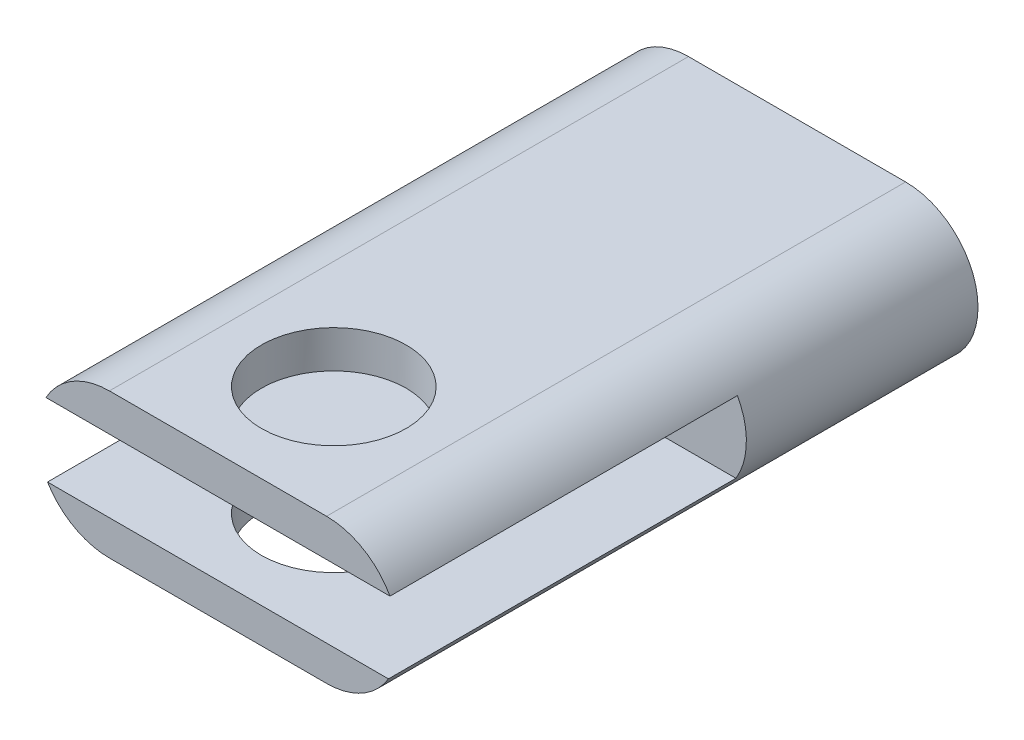
from build123d import *

# Parameters (mm, degrees)
BOSS_EXTRUDE1_DEPTH = 2000
SKETCH2_W           = 1250
SKETCH2_H           = 250
CUT_EXTRUDE1_DEPTH  = 1200
SKETCH3_R           = 250
CUT_EXTRUDE2_DEPTH  = 2155.210992452


with BuildPart() as part:
    # Sketch1 → Boss-Extrude1 (new body)
    with BuildSketch(Plane.XY):
        with BuildLine():
            Line((-375, 250), (375, 250))
            ThreePointArc((375, 250), (625, 0), (375, -250))
            Line((375, -250), (-375, -250))
            ThreePointArc((-375, -250), (-625, 0), (-375, 250))
        make_face()
    extrude(amount=BOSS_EXTRUDE1_DEPTH)

    # Sketch2 → Cut-Extrude1 (cut)
    with BuildSketch(Plane.XY.offset(2000)):
        with Locations((0, -4.467277721)):
            Rectangle(SKETCH2_W, SKETCH2_H)
    extrude(amount=-CUT_EXTRUDE1_DEPTH, mode=Mode.SUBTRACT)

    # Sketch3 → Cut-Extrude2 (cut, through all)
    with BuildSketch(Plane(origin=(0, 250, 0), x_dir=(1, 0, 0), z_dir=(0, 1, 0))):
        with Locations((0, -1600)):
            Circle(SKETCH3_R)
    extrude(amount=-CUT_EXTRUDE2_DEPTH, mode=Mode.SUBTRACT)


solid = part.part
